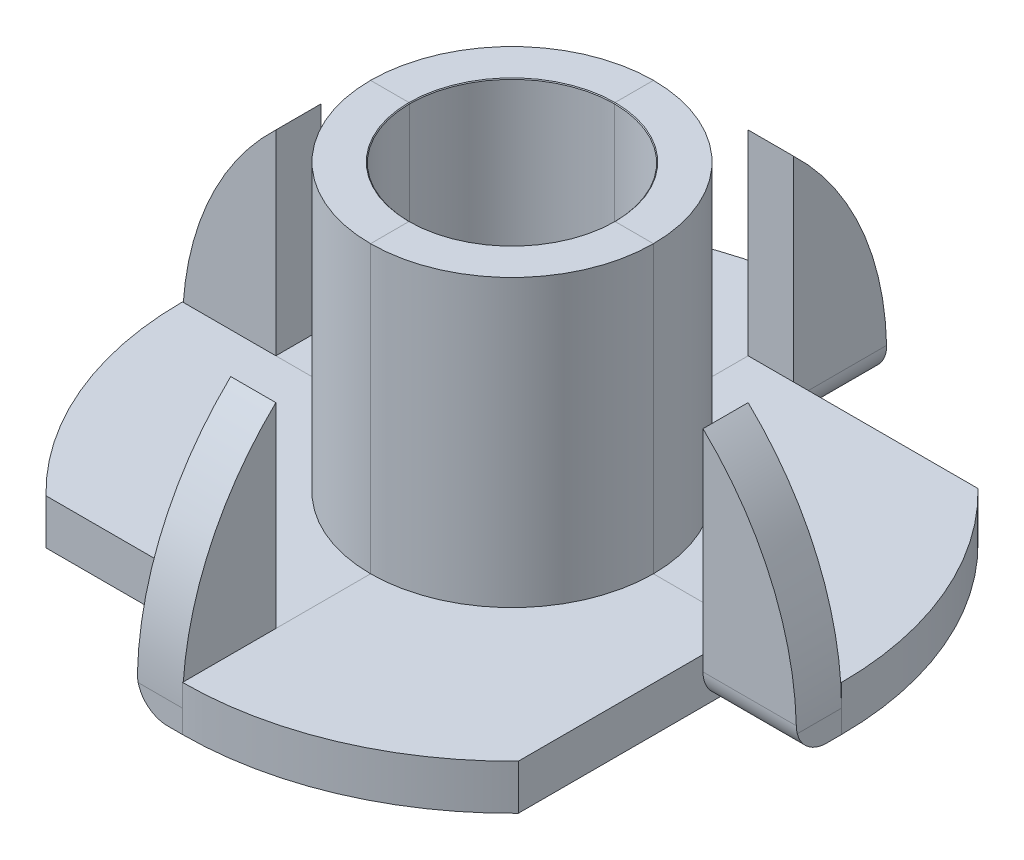
from build123d import *

# Parameters (mm, degrees)
BOSS_EXTRUDE1_DEPTH = 1.5
SKETCH2_W           = 3
SKETCH2_H           = 8
CUT_EXTRUDE1_DEPTH  = 1.5
SKETCH3_W           = 3.103226286
SKETCH3_H           = 1.5
BOSS_EXTRUDE2_DEPTH = 8
FILLET1_R           = 10
FILLET2_R           = 1
BOSS_EXTRUDE3_DEPTH = 11
CIRPATTERN1_COUNT   = 4


with BuildPart() as part:
    # Sketch1 → Boss-Extrude1 (new body)
    with BuildSketch(Plane(origin=(0, 0, 0), x_dir=(1, 0, 0), z_dir=(0, 1, 0))):
        with BuildLine():
            Line((-10.95, 0), (0, 0))
            Line((0, 0), (0, 10.95))
            ThreePointArc((0, 10.95), (-7.742819254, 7.742819254), (-10.95, 0))
        make_face()
    extrude(amount=BOSS_EXTRUDE1_DEPTH)

    # Sketch2 → Cut-Extrude1 (cut)
    with BuildSketch(Plane(origin=(0, 0, 0), x_dir=(1, 0, 0), z_dir=(0, 1, 0))):
        with Locations((-9.346773714, 5.5)):
            Rectangle(SKETCH2_W, SKETCH2_H)
    extrude(amount=CUT_EXTRUDE1_DEPTH, mode=Mode.SUBTRACT)

    # Sketch3 → Boss-Extrude2 (add)
    with BuildSketch(Plane(origin=(0, 0, 0), x_dir=(1, 0, 0), z_dir=(0, 1, 0))):
        with Locations((-9.398386857, 0.75)):
            Rectangle(SKETCH3_W, SKETCH3_H)
    extrude(amount=BOSS_EXTRUDE2_DEPTH)

    # Fillet1
    # the kernel refuses this fillet: 10 mm, written as the material it takes off along each edge
    with BuildSketch(Plane(origin=(-10.95, 8, -19.602919713), x_dir=(1, 0, 0), z_dir=(0, 0, 1))) as fillet1_piece_1:
        with BuildLine():
            CenterArc((10, -7.241167885), FILLET1_R, 133.604575442, 46.395424558)
            Line((0, -7.241167885), (-0.2, -7.241167885))
            Line((-0.2, -7.241167885), (-0.2, 0))
            Line((-0.2, 0), (0, 0.2))
            ThreePointArc((0, 0.2), (1.551613143, 0.2), (2.965290812, 0.144823358))
            Line((2.965290812, 0.144823358), (3.103226286, 0))
        make_face()
    extrude(amount=37.705839425, mode=Mode.SUBTRACT)

    # Fillet2
    fillet2_edges = [part.edges().sort_by_distance(p)[0] for p in [
        (-9.398386857, 0, -1.5),
    ]]
    fillet(fillet2_edges, radius=FILLET2_R)

    # Sketch4 → Boss-Extrude3 (add)
    with BuildSketch(Plane(origin=(0, 0, 0), x_dir=(1, 0, 0), z_dir=(0, 1, 0))):
        with BuildLine():
            Line((0, 0), (0, 4.7))
            ThreePointArc((0, 4.7), (-3.323401872, 3.323401872), (-4.7, 0))
            Line((-4.7, 0), (0, 0))
        make_face()
    extrude(amount=BOSS_EXTRUDE3_DEPTH)


with BuildPart() as cirpattern1_1:
    # CirPattern1: pattern copy
    add(part.part.rotate(Axis((0, 0, 0), (0, 1, 0)), 1 * 360 / CIRPATTERN1_COUNT))


with BuildPart() as cirpattern1_2:
    # CirPattern1: pattern copy
    add(part.part.rotate(Axis((0, 0, 0), (0, 1, 0)), 2 * 360 / CIRPATTERN1_COUNT))


with BuildPart() as cirpattern1_3:
    # CirPattern1: pattern copy
    add(part.part.rotate(Axis((0, 0, 0), (0, 1, 0)), 3 * 360 / CIRPATTERN1_COUNT))


with BuildPart() as tap_drill_for_m8_tap1_tool:
    # Sketch6 → Tap Drill for M8 Tap1 (revolve)
    with BuildSketch(Plane(origin=(0, 11, 0), x_dir=(0, 0, 1), z_dir=(1, 0, 0))):
        Polygon((0, 0), (0, 11), (3.4, 11), (3.4, 0.025), (3.425, 0), align=None)
    revolve(axis=Axis((0, 17.35, 0), (0, -1, 0)))


with BuildPart() as part_1:
    add(part.part)

    # Tap Drill for M8 Tap1: cut by tap_drill_for_m8_tap1_tool
    add(tap_drill_for_m8_tap1_tool.part, mode=Mode.SUBTRACT)


with BuildPart() as cirpattern1_1_1:
    add(cirpattern1_1.part)

    # Tap Drill for M8 Tap1: cut by tap_drill_for_m8_tap1_tool
    add(tap_drill_for_m8_tap1_tool.part, mode=Mode.SUBTRACT)


with BuildPart() as cirpattern1_2_1:
    add(cirpattern1_2.part)

    # Tap Drill for M8 Tap1: cut by tap_drill_for_m8_tap1_tool
    add(tap_drill_for_m8_tap1_tool.part, mode=Mode.SUBTRACT)


with BuildPart() as cirpattern1_3_1:
    add(cirpattern1_3.part)

    # Tap Drill for M8 Tap1: cut by tap_drill_for_m8_tap1_tool
    add(tap_drill_for_m8_tap1_tool.part, mode=Mode.SUBTRACT)


solid = Compound([part_1.part, cirpattern1_1_1.part, cirpattern1_2_1.part, cirpattern1_3_1.part])
